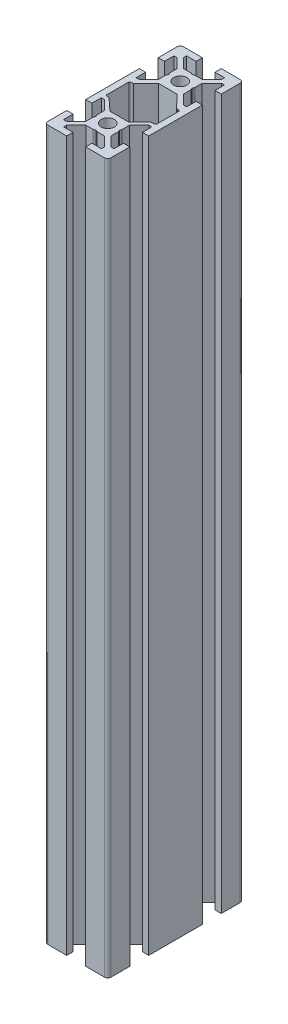
from build123d import *

# Parameters (mm, degrees)
BOSS_EXTRUDE3_DEPTH = 450


with BuildPart() as part:
    # Sketch3 → Boss-Extrude3 (new body)
    with BuildSketch(Plane(origin=(0, 0, 0), x_dir=(1, 0, 0), z_dir=(0, 1, 0))):
        with BuildLine():
            Line((-19.793292069, 34.034451322), (-19.793292069, 0.034451322))
            Line((-19.793292069, 0.034451322), (-15.793292069, 0.034451322))
            Line((-15.793292069, 0.034451322), (-15.793292069, 6.034451322))
            Line((-15.793292069, 6.034451322), (-13.914612413, 6.034451322))
            Line((-13.914612413, 6.034451322), (-7.793292069, -0.086869022))
            Line((-7.793292069, -0.086869022), (-7.793292069, -0.965548678))
            Line((-7.793292069, -0.965548678), (-7.793292069, -4.658369001))
            ThreePointArc((-7.793292069, -4.658369001), (-7.759217896, -4.917188046), (-7.659317473, -5.158369001))
            Line((-7.659317473, -5.158369001), (-7.193292069, -5.965548678))
            Line((-7.193292069, -5.965548678), (-7.659317473, -6.772728355))
            ThreePointArc((-7.659317473, -6.772728355), (-7.759217896, -7.01390931), (-7.793292069, -7.272728355))
            Line((-7.793292069, -7.272728355), (-7.793292069, -11.844228335))
            Line((-7.793292069, -11.844228335), (-13.914612413, -17.965548678))
            Line((-13.914612413, -17.965548678), (-15.793292069, -17.965548678))
            Line((-15.793292069, -17.965548678), (-15.793292069, -11.965548678))
            Line((-15.793292069, -11.965548678), (-19.793292069, -11.965548678))
            Line((-19.793292069, -11.965548678), (-19.793292069, -23.965548678))
            ThreePointArc((-19.793292069, -23.965548678), (-19.207505632, -25.379762241), (-17.793292069, -25.965548678))
            Line((-17.793292069, -25.965548678), (-5.793292069, -25.965548678))
            Line((-5.793292069, -25.965548678), (-5.793292069, -21.965548678))
            Line((-5.793292069, -21.965548678), (-11.793292069, -21.965548678))
            Line((-11.793292069, -21.965548678), (-11.793292069, -20.086869022))
            Line((-11.793292069, -20.086869022), (-5.671971726, -13.965548678))
            Line((-5.671971726, -13.965548678), (-4.793292069, -13.965548678))
            Line((-4.793292069, -13.965548678), (-1.100471746, -13.965548678))
            ThreePointArc((-1.100471746, -13.965548678), (-0.841652701, -13.931474504), (-0.600471746, -13.831574082))
            Line((-0.600471746, -13.831574082), (0.206707931, -13.365548678))
            Line((0.206707931, -13.365548678), (1.013887608, -13.831574082))
            ThreePointArc((1.013887608, -13.831574082), (1.255068563, -13.931474505), (1.513887608, -13.965548678))
            Line((1.513887608, -13.965548678), (6.085387587, -13.965548678))
            Line((6.085387587, -13.965548678), (12.206707931, -20.086869022))
            Line((12.206707931, -20.086869022), (12.206707931, -21.965548678))
            Line((12.206707931, -21.965548678), (6.206707931, -21.965548678))
            Line((6.206707931, -21.965548678), (6.206707931, -25.965548678))
            Line((6.206707931, -25.965548678), (18.206707931, -25.965548678))
            ThreePointArc((18.206707931, -25.965548678), (19.620921493, -25.379762241), (20.206707931, -23.965548678))
            Line((20.206707931, -23.965548678), (20.206707931, -11.965548678))
            Line((20.206707931, -11.965548678), (16.206707931, -11.965548678))
            Line((16.206707931, -11.965548678), (16.206707931, -17.965548678))
            Line((16.206707931, -17.965548678), (14.328028274, -17.965548678))
            Line((14.328028274, -17.965548678), (8.206707931, -11.844228335))
            Line((8.206707931, -11.844228335), (8.206707931, -10.965548678))
            Line((8.206707931, -10.965548678), (8.206707931, -7.272728355))
            ThreePointArc((8.206707931, -7.272728355), (8.172633757, -7.01390931), (8.072733335, -6.772728355))
            Line((8.072733335, -6.772728355), (7.606707931, -5.965548678))
            Line((7.606707931, -5.965548678), (8.072733335, -5.158369001))
            ThreePointArc((8.072733335, -5.158369001), (8.172633757, -4.917188046), (8.206707931, -4.658369001))
            Line((8.206707931, -4.658369001), (8.206707931, -0.086869022))
            Line((8.206707931, -0.086869022), (14.328028274, 6.034451322))
            Line((14.328028274, 6.034451322), (16.206707931, 6.034451322))
            Line((16.206707931, 6.034451322), (16.206707931, 0.034451322))
            Line((16.206707931, 0.034451322), (20.206707931, 0.034451322))
            Line((20.206707931, 0.034451322), (20.206707931, 34.034451322))
            Line((20.206707931, 34.034451322), (16.206707931, 34.034451322))
            Line((16.206707931, 34.034451322), (16.206707931, 28.034451322))
            Line((16.206707931, 28.034451322), (14.328028274, 28.034451322))
            Line((14.328028274, 28.034451322), (8.206707931, 34.155771665))
            Line((8.206707931, 34.155771665), (8.206707931, 38.727271645))
            ThreePointArc((8.206707931, 38.727271645), (8.172633757, 38.98609069), (8.072733335, 39.227271645))
            Line((8.072733335, 39.227271645), (7.606707931, 40.034451322))
            Line((7.606707931, 40.034451322), (8.072733335, 40.841630999))
            ThreePointArc((8.072733335, 40.841630999), (8.172633757, 41.082811954), (8.206707931, 41.341630999))
            Line((8.206707931, 41.341630999), (8.206707931, 45.034451322))
            Line((8.206707931, 45.034451322), (8.206707931, 45.913130978))
            Line((8.206707931, 45.913130978), (14.328028274, 52.034451322))
            Line((14.328028274, 52.034451322), (16.206707931, 52.034451322))
            Line((16.206707931, 52.034451322), (16.206707931, 46.034451322))
            Line((16.206707931, 46.034451322), (20.206707931, 46.034451322))
            Line((20.206707931, 46.034451322), (20.206707931, 58.034451322))
            ThreePointArc((20.206707931, 58.034451322), (19.620921493, 59.448664884), (18.206707931, 60.034451322))
            Line((18.206707931, 60.034451322), (6.206707931, 60.034451322))
            Line((6.206707931, 60.034451322), (6.206707931, 56.034451322))
            Line((6.206707931, 56.034451322), (12.206707931, 56.034451322))
            Line((12.206707931, 56.034451322), (12.206707931, 54.155771665))
            Line((12.206707931, 54.155771665), (6.085387587, 48.034451322))
            Line((6.085387587, 48.034451322), (1.513887608, 48.034451322))
            ThreePointArc((1.513887608, 48.034451322), (1.255068563, 48.000377148), (1.013887608, 47.900476726))
            Line((1.013887608, 47.900476726), (0.206707931, 47.434451322))
            Line((0.206707931, 47.434451322), (-0.600471746, 47.900476726))
            ThreePointArc((-0.600471746, 47.900476726), (-0.841652701, 48.000377148), (-1.100471746, 48.034451322))
            Line((-1.100471746, 48.034451322), (-4.793292069, 48.034451322))
            Line((-4.793292069, 48.034451322), (-5.671971726, 48.034451322))
            Line((-5.671971726, 48.034451322), (-11.793292069, 54.155771665))
            Line((-11.793292069, 54.155771665), (-11.793292069, 56.034451322))
            Line((-11.793292069, 56.034451322), (-5.793292069, 56.034451322))
            Line((-5.793292069, 56.034451322), (-5.793292069, 60.034451322))
            Line((-5.793292069, 60.034451322), (-17.793292069, 60.034451322))
            ThreePointArc((-17.793292069, 60.034451322), (-19.207505632, 59.448664884), (-19.793292069, 58.034451322))
            Line((-19.793292069, 58.034451322), (-19.793292069, 46.034451322))
            Line((-19.793292069, 46.034451322), (-15.793292069, 46.034451322))
            Line((-15.793292069, 46.034451322), (-15.793292069, 52.034451322))
            Line((-15.793292069, 52.034451322), (-13.914612413, 52.034451322))
            Line((-13.914612413, 52.034451322), (-7.793292069, 45.913130978))
            Line((-7.793292069, 45.913130978), (-7.793292069, 41.341630999))
            ThreePointArc((-7.793292069, 41.341630999), (-7.759217896, 41.082811954), (-7.659317473, 40.841630999))
            Line((-7.659317473, 40.841630999), (-7.193292069, 40.034451322))
            Line((-7.193292069, 40.034451322), (-7.659317473, 39.227271645))
            ThreePointArc((-7.659317473, 39.227271645), (-7.759217896, 38.98609069), (-7.793292069, 38.727271645))
            Line((-7.793292069, 38.727271645), (-7.793292069, 35.034451322))
            Line((-7.793292069, 35.034451322), (-7.793292069, 34.155771665))
            Line((-7.793292069, 34.155771665), (-13.914612413, 28.034451322))
            Line((-13.914612413, 28.034451322), (-15.793292069, 28.034451322))
            Line((-15.793292069, 28.034451322), (-15.793292069, 34.034451322))
            Line((-15.793292069, 34.034451322), (-19.793292069, 34.034451322))
        make_face()
        with BuildLine():
            Line((-13.889365539, 24), (-15.162157745, 23.8))
            ThreePointArc((-15.162157745, 23.8), (-15.467183841, 23.715078288), (-15.762157745, 23.6))
            Line((-15.762157745, 23.6), (-15.762157745, 9.27900974))
            Line((-15.762157745, 9.27900974), (-15.162157745, 8.67900974))
            Line((-15.162157745, 8.67900974), (-13.889365539, 8.67900974))
            ThreePointArc((-13.889365539, 8.67900974), (-13.67377328, 8.599495494), (-13.46510147, 8.50327381))
            Line((-13.46510147, 8.50327381), (-5.640837401, 1.32099026))
            Line((-5.640837401, 1.32099026), (6.085387587, 1.32099026))
            Line((6.085387587, 1.32099026), (12.927454117, 8.359477027))
            Line((12.927454117, 8.359477027), (15.116699581, 8.359477027))
            Line((15.116699581, 8.359477027), (15.355884641, 8.37173312))
            Line((15.355884641, 8.37173312), (16.237842255, 9.27900974))
            Line((16.237842255, 9.27900974), (16.206707931, 23.6))
            Line((16.206707931, 23.6), (14.365050049, 24))
            ThreePointArc((14.365050049, 24), (14.152918015, 23.993269257), (13.94078598, 24))
            Line((13.94078598, 24), (6.116521912, 32))
            Line((6.116521912, 32), (-5.640837401, 32))
            Line((-5.640837401, 32), (-13.46510147, 24))
            ThreePointArc((-13.46510147, 24), (-13.677233504, 23.993269257), (-13.889365539, 24))
        make_face(mode=Mode.SUBTRACT)
        with BuildLine():
            ThreePointArc((-3.979594415, -5.965548678), (0.220405585, -10.165548678), (4.420405585, -5.965548678))
            ThreePointArc((4.420405585, -5.965548678), (0.220405585, -1.765548678), (-3.979594415, -5.965548678))
        make_face(mode=Mode.SUBTRACT)
        with BuildLine():
            ThreePointArc((-3.993292069, 40.034451322), (0.206707931, 35.834451322), (4.406707931, 40.034451322))
            ThreePointArc((4.406707931, 40.034451322), (0.206707931, 44.234451322), (-3.993292069, 40.034451322))
        make_face(mode=Mode.SUBTRACT)
    extrude(amount=BOSS_EXTRUDE3_DEPTH)


solid = part.part
